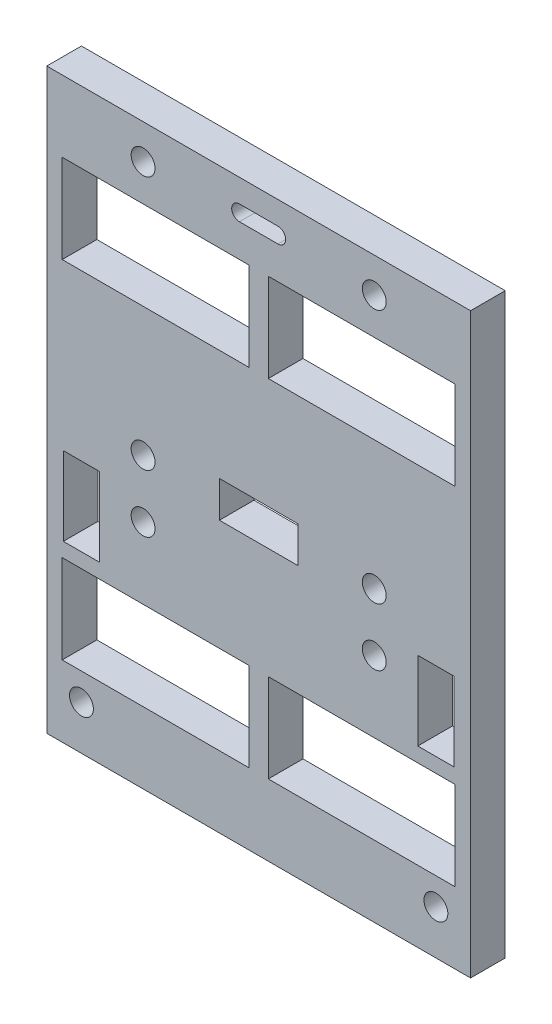
from build123d import *

# Parameters (mm, degrees)
SKETCH1_W                 = 55
SKETCH1_H                 = 75
SKETCH1_W_2               = 24.25
SKETCH1_H_2               = 11.5
BOSS_EXTRUDE1_DEPTH       = 4.5
SKETCH2_R                 = 1.55
SCREWHOLES_DEPTH          = 47.719910103
SKETCH4_W                 = 10.2
SKETCH4_H                 = 4.7
MOUNTINGPLATETAB_DEPTH    = 47.719910103
SKETCH5_R                 = 1.55
SKETCH5_W                 = 4.7
SKETCH5_H                 = 10.2
BRACETABS_DEPTH           = 47.719910103
SKETCH8_R                 = 1.55
EXPANSIONSCREWHOLES_DEPTH = 47.719910103
CABLETIESLOT_DEPTH        = 47.719910103


with BuildPart() as part:
    # Sketch1 → Boss-Extrude1 (new body)
    with BuildSketch(Plane.XY):
        Rectangle(SKETCH1_W, SKETCH1_H)
        with Locations((-13.375, 22.5)):
            Rectangle(SKETCH1_W_2, SKETCH1_H_2, mode=Mode.SUBTRACT)
        with Locations((13.375, 22.5)):
            Rectangle(SKETCH1_W_2, SKETCH1_H_2, mode=Mode.SUBTRACT)
        with Locations((13.375, -22.5)):
            Rectangle(SKETCH1_W_2, SKETCH1_H_2, mode=Mode.SUBTRACT)
        with Locations((-13.375, -22.5)):
            Rectangle(SKETCH1_W_2, SKETCH1_H_2, mode=Mode.SUBTRACT)
    extrude(amount=BOSS_EXTRUDE1_DEPTH)

    # Sketch2 → screwHoles (cut, through all)
    with BuildSketch(Plane.XY.offset(4.5)):
        with Locations((-15, 33)):
            Circle(SKETCH2_R)
        with Locations((15, 33)):
            Circle(SKETCH2_R)
        with Locations((15, 0)):
            Circle(SKETCH2_R)
        with Locations((-15, 0)):
            Circle(SKETCH2_R)
    extrude(amount=-SCREWHOLES_DEPTH, mode=Mode.SUBTRACT)

    # Sketch4 → mountingPlateTab (cut, through all)
    with BuildSketch(Plane.XY.offset(4.5)):
        Rectangle(SKETCH4_W, SKETCH4_H)
    extrude(amount=-MOUNTINGPLATETAB_DEPTH, mode=Mode.SUBTRACT)

    # Sketch5 → BraceTabs (cut, through all)
    with BuildSketch(Plane.XY.offset(4.5)):
        with Locations((23, -31.75)):
            Circle(SKETCH5_R)
        with Locations((-23, -31.75)):
            Circle(SKETCH5_R)
        with Locations((23, -9.75)):
            Rectangle(SKETCH5_W, SKETCH5_H)
        with Locations((-23, -9.75)):
            Rectangle(SKETCH5_W, SKETCH5_H)
    extrude(amount=-BRACETABS_DEPTH, mode=Mode.SUBTRACT)

    # Sketch8 → ExpansionScrewholes (cut, through all)
    with BuildSketch(Plane.XY.offset(4.5)):
        with Locations((-15, -7.5)):
            Circle(SKETCH8_R)
        with Locations((15, -7.5)):
            Circle(SKETCH8_R)
    extrude(amount=-EXPANSIONSCREWHOLES_DEPTH, mode=Mode.SUBTRACT)

    # Sketch12 → CableTieSlot (cut, through all)
    with BuildSketch(Plane.XY.offset(4.5)):
        with BuildLine():
            Line((-2.5, 34.5), (2.5, 34.5))
            ThreePointArc((2.5, 34.5), (3.5, 33.5), (2.5, 32.5))
            Line((2.5, 32.5), (-2.5, 32.5))
            ThreePointArc((-2.5, 32.5), (-3.5, 33.5), (-2.5, 34.5))
        make_face()
    extrude(amount=-CABLETIESLOT_DEPTH, mode=Mode.SUBTRACT)


solid = part.part
